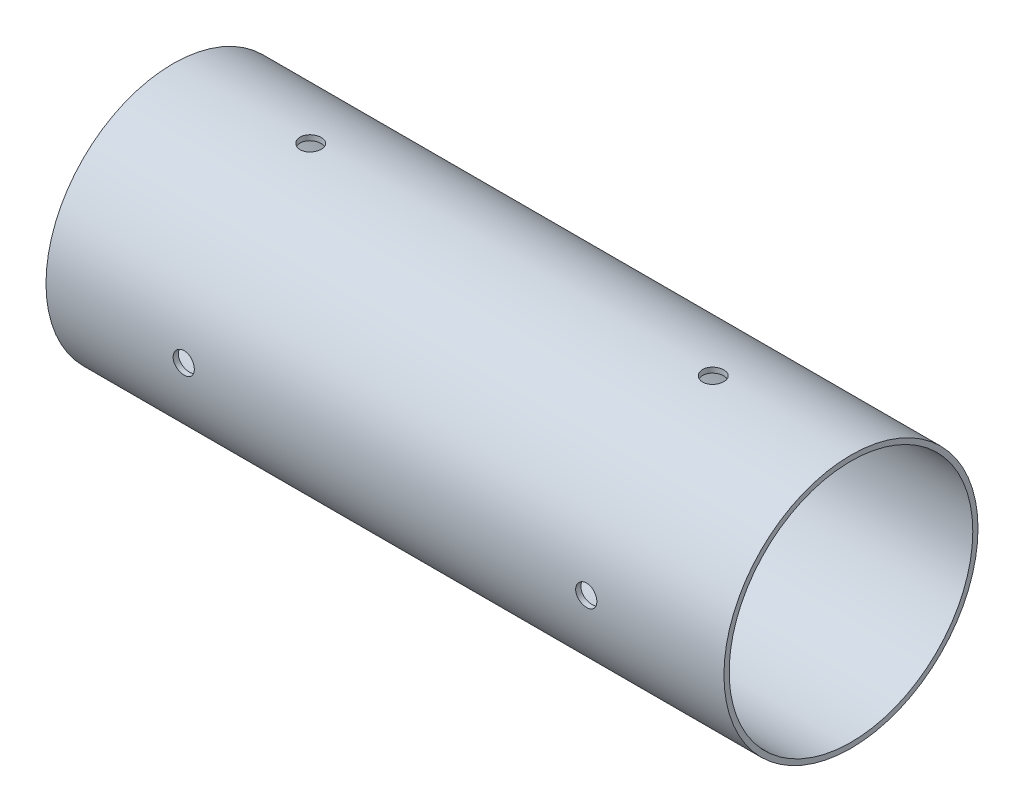
from build123d import *

# Parameters (mm, degrees)
SKETCH1_R           = 38.0746
SKETCH1_R_2         = 36.5125
BOSS_EXTRUDE1_DEPTH = 203.2
SKETCH3_R           = 3.175
CUT_EXTRUDE1_DEPTH  = 211.213202084
CIRPATTERN1_COUNT   = 4
SKETCH4_R           = 3.175
CUT_EXTRUDE2_DEPTH  = 211.213202217
CIRPATTERN2_COUNT   = 4


with BuildPart() as part:
    # Sketch1 → Boss-Extrude1 (new body)
    with BuildSketch(Plane.YZ):
        Circle(SKETCH1_R)
        Circle(SKETCH1_R_2, mode=Mode.SUBTRACT)
    extrude(amount=BOSS_EXTRUDE1_DEPTH)

    # Sketch3 → Cut-Extrude1 (cut, through all)
    with BuildSketch(Plane(origin=(0, 0, 0), x_dir=(-1, 0, 0), z_dir=(0, 1, 0))):
        with Locations((-161.925, 0)):
            Circle(SKETCH3_R)
    cut_extrude1 = extrude(amount=CUT_EXTRUDE1_DEPTH, mode=Mode.SUBTRACT)

    # CirPattern1: Cut-Extrude1 ×4 about axis
    cirpattern1_axis = Axis((203.2, 0, 0), (-1, 0, 0))
    for i in range(1, CIRPATTERN1_COUNT):
        add(cut_extrude1.rotate(cirpattern1_axis, i * 360 / CIRPATTERN1_COUNT), mode=Mode.SUBTRACT)

    # Sketch4 → Cut-Extrude2 (cut, through all)
    with BuildSketch(Plane(origin=(0, 0, 0), x_dir=(-1, 0, 0), z_dir=(0, 1, 0))):
        with Locations((-41.275, 0)):
            Circle(SKETCH4_R)
    cut_extrude2 = extrude(amount=CUT_EXTRUDE2_DEPTH, mode=Mode.SUBTRACT)

    # CirPattern2: Cut-Extrude2 ×4 about axis
    cirpattern2_axis = Axis((203.2, 0, 0), (-1, 0, 0))
    for i in range(1, CIRPATTERN2_COUNT):
        add(cut_extrude2.rotate(cirpattern2_axis, i * 360 / CIRPATTERN2_COUNT), mode=Mode.SUBTRACT)


solid = part.part
